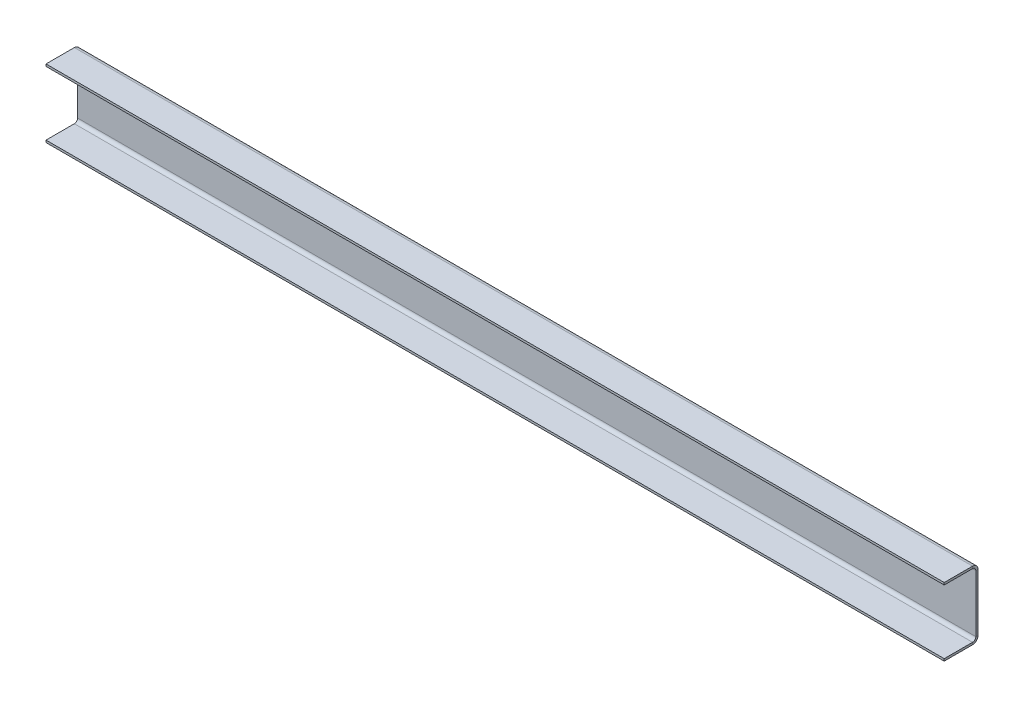
from build123d import *

# Parameters (mm, degrees)
SKETCH1_W                    = 1648
SKETCH1_H                    = 125
BASE_FLANGE1_DEPTH           = 4
EDGE_FLANGE1_STRIP_W         = 28
EDGE_FLANGE1_STRIP_H         = 4
EDGE_FLANGE1_STRIP_CUT_DEPTH = 1648
EDGE_FLANGE1_DEPTH           = 1648
EDGE_FLANGE2_STRIP_W         = 28
EDGE_FLANGE2_STRIP_H         = 4
EDGE_FLANGE2_STRIP_CUT_DEPTH = 1648
EDGE_FLANGE2_DEPTH           = 1648


# Sheet-metal steps are written as plain solids
with BuildPart() as part:
    # Sketch1 → Base-Flange1 (new body)
    with BuildSketch(Plane.XY):
        with Locations((-340.8723099, 44.386657102)):
            Rectangle(SKETCH1_W, SKETCH1_H)
    extrude(amount=-BASE_FLANGE1_DEPTH)

    # Edge-Flange1 strip (across the edge) → Edge-Flange1 strip cut (cut)
    with BuildSketch(Plane(origin=(483.1276901, 106.886657102, 0), x_dir=(0, -1, 0), z_dir=(-1, 0, 0))):
        with Locations((-4, -2)):
            Rectangle(EDGE_FLANGE1_STRIP_W, EDGE_FLANGE1_STRIP_H)
    extrude(amount=EDGE_FLANGE1_STRIP_CUT_DEPTH, mode=Mode.SUBTRACT)

    # Edge-Flange1 section (across the edge) → Edge-Flange1 (add)
    with BuildSketch(Plane(origin=(483.1276901, 106.886657102, 0), x_dir=(0, -1, 0), z_dir=(-1, 0, 0))):
        with BuildLine():
            Line((0, 6), (0, 58))
            Line((0, 58), (4, 58))
            Line((4, 58), (4, 6))
            ThreePointArc((4, 6), (5.757359313, 1.757359313), (10, 0))
            Line((10, 0), (10, -4))
            ThreePointArc((10, -4), (2.928932188, -1.071067812), (0, 6))
        make_face()
    extrude(amount=EDGE_FLANGE1_DEPTH)

    # Edge-Flange2 strip (across the edge) → Edge-Flange2 strip cut (cut)
    with BuildSketch(Plane(origin=(-1164.8723099, -18.113342898, 0), x_dir=(0, 1, 0), z_dir=(1, 0, 0))):
        with Locations((-4, -2)):
            Rectangle(EDGE_FLANGE2_STRIP_W, EDGE_FLANGE2_STRIP_H)
    extrude(amount=EDGE_FLANGE2_STRIP_CUT_DEPTH, mode=Mode.SUBTRACT)

    # Edge-Flange2 section (across the edge) → Edge-Flange2 (add)
    with BuildSketch(Plane(origin=(-1164.8723099, -18.113342898, 0), x_dir=(0, 1, 0), z_dir=(1, 0, 0))):
        with BuildLine():
            Line((0, 6), (0, 58))
            Line((0, 58), (4, 58))
            Line((4, 58), (4, 6))
            ThreePointArc((4, 6), (5.757359313, 1.757359313), (10, 0))
            Line((10, 0), (10, -4))
            ThreePointArc((10, -4), (2.928932188, -1.071067812), (0, 6))
        make_face()
    extrude(amount=EDGE_FLANGE2_DEPTH)


solid = part.part
